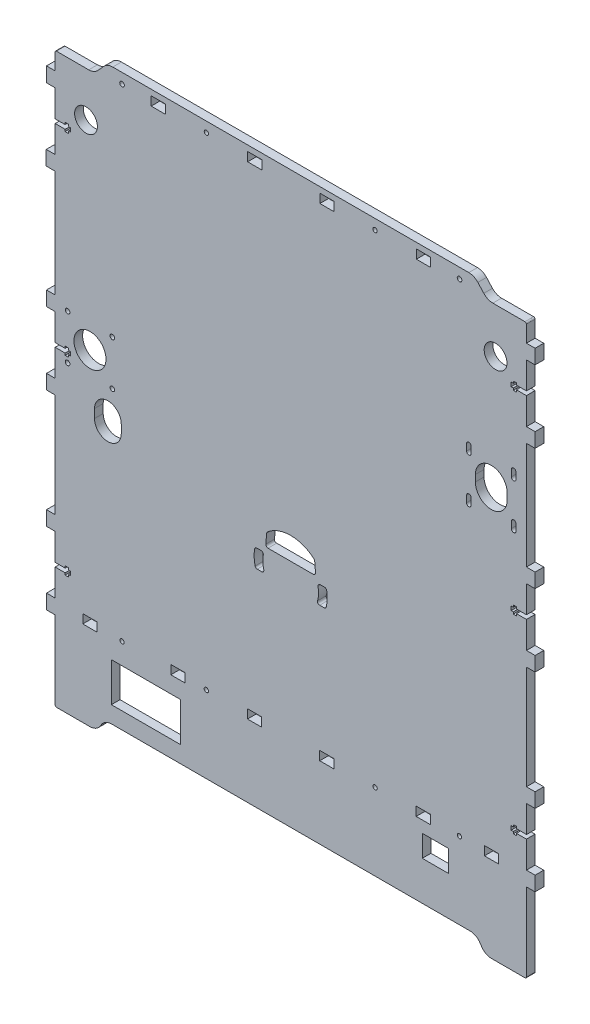
from build123d import *

# Parameters (mm, degrees)
SKETCH_1_R      = 7.9
SKETCH_1_R_2    = 1.6
SKETCH_1_R_3    = 1.5
SKETCH_1_R_4    = 11.1
SKETCH_1_W      = 9.849167497
SKETCH_1_H      = 6.19978722
SKETCH_1_W_2    = 9.849167498
SKETCH_1_H_2    = 6.199787221
SKETCH_1_W_3    = 18
SKETCH_1_H_3    = 15
SKETCH_1_W_4    = 9.849202775
SKETCH_1_W_5    = 48
SKETCH_1_H_4    = 27
SKETCH_1_W_6    = 9.849167249
SKETCH_1_W_7    = 9.849202526
SKETCH_1_W_8    = 9.849202527
EXTRUDE_1_DEPTH = 6


with BuildPart() as part:
    # Эскиз1 → Бобышка-Вытянуть1 (new body)
    with BuildSketch(Plane.XY):
        with BuildLine():
            Line((-197.694445684, 21.332964363), (-197.694445684, 19.960068421))
            Line((-197.694445684, 19.960068421), (-195.493623102, 19.960068421))
            Line((-195.493623102, 19.960068421), (-195.494445174, 21.332741303))
            Line((-195.494445174, 21.332741303), (-195.494445174, 21.359949385))
            Line((-195.494445174, 21.359949385), (-193.994445433, 21.360830251))
            Line((-193.994445433, 21.360830251), (-193.996089178, 24.132704975))
            Line((-193.996089178, 24.132704975), (-193.996089178, 24.159913057))
            Line((-193.996089178, 24.159913057), (-195.496088919, 24.159032191))
            Line((-195.496088919, 24.159032191), (-195.4969116, 25.532741364))
            Line((-195.4969116, 25.532741364), (-195.4969116, 25.559949446))
            Line((-195.4969116, 25.559949446), (-197.69691201, 25.560002787))
            Line((-197.69691201, 25.560002787), (-197.69691201, 25.532794704))
            Line((-197.69691201, 25.532794704), (-197.696945954, 24.160002787))
            Line((-197.696945954, 24.160002787), (-204.606387984, 24.161192722))
            Line((-204.606387984, 24.161192722), (-204.606387984, 42.758944112))
            Line((-204.606387984, 42.758944112), (-210.606387984, 42.758944112))
            Line((-210.606387984, 42.758944112), (-210.606387984, 52.73173603))
            Line((-210.606387984, 52.73173603), (-204.606387984, 52.73173603))
            Line((-204.606387984, 52.73173603), (-204.606387984, 126.895645125))
            Line((-204.606387984, 126.895645125), (-210.782446891, 126.895645125))
            Line((-210.782446891, 126.895645125), (-210.782446891, 136.895645125))
            Line((-210.782446891, 136.895645125), (-204.606387984, 136.895645125))
            Line((-204.606387984, 136.895645125), (-204.606387984, 155.499785996))
            Line((-204.606387984, 155.499785996), (-197.694445684, 155.499785996))
            Line((-197.694445684, 155.499785996), (-197.694445684, 154.099681972))
            Line((-197.694445684, 154.099681972), (-195.493623102, 154.099681972))
            Line((-195.493623102, 154.099681972), (-195.494445174, 155.499562936))
            Line((-195.494445174, 155.499562936), (-193.994445433, 155.500443802))
            Line((-193.994445433, 155.500443802), (-193.996089178, 158.299526608))
            Line((-193.996089178, 158.299526608), (-195.496088919, 158.298645742))
            Line((-195.496088919, 158.298645742), (-195.4969116, 159.699562997))
            Line((-195.4969116, 159.699562997), (-197.69691201, 159.699616338))
            Line((-197.69691201, 159.699616338), (-197.696945954, 158.299616338))
            Line((-197.696945954, 158.299616338), (-204.606387984, 158.300806273))
            Line((-204.606387984, 158.300806273), (-204.606387984, 176.905311214))
            Line((-204.606387984, 176.905311214), (-210.606387984, 176.905311214))
            Line((-210.606387984, 176.905311214), (-210.606387984, 187.047679378))
            Line((-210.606387984, 187.047679378), (-204.606387984, 187.047679378))
            Line((-204.606387984, 187.047679378), (-204.606387984, 198.305988871))
            ThreePointArc((-204.606387984, 198.305988871), (-204.401524219, 198.976632659), (-203.782446891, 199.305988871))
            Line((-203.782446891, 199.305988871), (-181.349535501, 199.305988871))
            ThreePointArc((-181.349535501, 199.305988871), (-177.923844093, 200.026873345), (-175.079218037, 202.06725043))
            Line((-175.079218037, 202.06725043), (-170.981328441, 206.544727313))
            ThreePointArc((-170.981328441, 206.544727313), (-168.136702385, 208.585104398), (-164.711010976, 209.305988871))
            Line((-164.711010976, 209.305988871), (81.698235008, 209.305988871))
            ThreePointArc((81.698235008, 209.305988871), (85.123926416, 208.585104398), (87.968552472, 206.544727313))
            Line((87.968552472, 206.544727313), (92.066442069, 202.06725043))
            ThreePointArc((92.066442069, 202.06725043), (94.911068125, 200.026873345), (98.336759533, 199.305988871))
            Line((98.336759533, 199.305988871), (120.593612016, 199.305988871))
            ThreePointArc((120.593612016, 199.305988871), (121.300718797, 199.013095653), (121.593612016, 198.305988871))
            Line((121.593612016, 198.305988871), (121.593612016, 186.905311214))
            Line((121.593612016, 186.905311214), (127.593612016, 186.905311214))
            Line((127.593612016, 186.905311214), (127.593612016, 176.905311214))
            Line((127.593612016, 176.905311214), (121.593612016, 176.905311214))
            Line((121.593612016, 176.905311214), (121.593612016, 158.300806273))
            Line((121.593612016, 158.300806273), (114.681610809, 158.300806273))
            Line((114.681610809, 158.300806273), (114.681610809, 159.700910297))
            Line((114.681610809, 159.700910297), (112.480788227, 159.700910297))
            Line((112.480788227, 159.700910297), (112.481610299, 158.301029333))
            Line((112.481610299, 158.301029333), (110.981610557, 158.300148467))
            Line((110.981610557, 158.300148467), (110.983254303, 155.501065661))
            Line((110.983254303, 155.501065661), (112.483254044, 155.501946527))
            Line((112.483254044, 155.501946527), (112.484076725, 154.101029272))
            Line((112.484076725, 154.101029272), (114.684077135, 154.100975932))
            Line((114.684077135, 154.100975932), (114.684111079, 155.500975931))
            Line((114.684111079, 155.500975931), (121.593612016, 155.499785996))
            Line((121.593612016, 155.499785996), (121.593612016, 136.895645125))
            Line((121.593612016, 136.895645125), (127.593612016, 136.895645125))
            Line((127.593612016, 136.895645125), (127.593612016, 126.895645125))
            Line((127.593612016, 126.895645125), (121.593612016, 126.895645125))
            Line((121.593612016, 126.895645125), (121.593612016, 52.73173603))
            Line((121.593612016, 52.73173603), (127.593612016, 52.73173603))
            Line((127.593612016, 52.73173603), (127.593612016, 42.758944112))
            Line((127.593612016, 42.758944112), (121.593612016, 42.758944112))
            Line((121.593612016, 42.758944112), (121.593612016, 24.160597755))
            Line((121.593612016, 24.160597755), (121.593612016, 24.133528549))
            Line((121.593612016, 24.133528549), (114.681610809, 24.133528549))
            Line((114.681610809, 24.133528549), (114.681610809, 24.160597755))
            Line((114.681610809, 24.160597755), (114.681610809, 25.533632573))
            Line((114.681610809, 25.533632573), (112.480788227, 25.533632573))
            Line((112.480788227, 25.533632573), (112.481610299, 24.160820814))
            Line((112.481610299, 24.160820814), (112.481610299, 24.133751609))
            Line((112.481610299, 24.133751609), (110.981610557, 24.132870742))
            Line((110.981610557, 24.132870742), (110.983254303, 21.360857142))
            Line((110.983254303, 21.360857142), (110.983254303, 21.333787936))
            Line((110.983254303, 21.333787936), (112.483254044, 21.334668803))
            Line((112.483254044, 21.334668803), (112.484076725, 19.960820753))
            Line((112.484076725, 19.960820753), (112.484076725, 19.933751548))
            Line((112.484076725, 19.933751548), (114.684077135, 19.933698207))
            Line((114.684077135, 19.933698207), (114.684077135, 19.960767413))
            Line((114.684077135, 19.960767413), (114.684111079, 21.333698207))
            Line((114.684111079, 21.333698207), (121.593612016, 21.332508272))
            Line((121.593612016, 21.332508272), (121.593612016, 2.729791245))
            Line((121.593612016, 2.729791245), (127.593612016, 2.729791245))
            Line((127.593612016, 2.729791245), (127.593612016, -7.243000673))
            Line((127.593612016, -7.243000673), (121.593612016, -7.243000673))
            Line((121.593612016, -7.243000673), (121.593612016, -78.973178087))
            Line((121.593612016, -78.973178087), (127.593612016, -78.973178087))
            Line((127.593612016, -78.973178087), (127.593612016, -88.973178087))
            Line((127.593612016, -88.973178087), (121.681612016, -88.973178087))
            Line((121.681612016, -88.973178087), (121.681612016, -107.555053324))
            Line((121.681612016, -107.555053324), (114.681610809, -107.555053324))
            Line((114.681610809, -107.555053324), (114.681610809, -106.154949299))
            Line((114.681610809, -106.154949299), (112.480788227, -106.154949299))
            Line((112.480788227, -106.154949299), (112.481610299, -107.554830264))
            Line((112.481610299, -107.554830264), (110.981610557, -107.55571113))
            Line((110.981610557, -107.55571113), (110.983254303, -110.354793936))
            Line((110.983254303, -110.354793936), (112.483254044, -110.35391307))
            Line((112.483254044, -110.35391307), (112.484076725, -111.754830325))
            Line((112.484076725, -111.754830325), (114.684077135, -111.754883665))
            Line((114.684077135, -111.754883665), (114.684111079, -110.354883666))
            Line((114.684111079, -110.354883666), (121.593612016, -110.356073601))
            Line((121.593612016, -110.356073601), (121.593612016, -128.962877955))
            Line((121.593612016, -128.962877955), (127.593612016, -128.962877955))
            Line((127.593612016, -128.962877955), (127.593612016, -138.962877955))
            Line((127.593612016, -138.962877955), (121.593612016, -138.962877955))
            Line((121.593612016, -138.962877955), (121.593612016, -193.00506208))
            ThreePointArc((121.593612016, -193.00506208), (121.256718797, -193.730394258), (120.505612016, -194.00506208))
            Line((120.505612016, -194.00506208), (97.46922711, -194.00506208))
            ThreePointArc((97.46922711, -194.00506208), (93.920971885, -193.198923704), (91.045849344, -190.968756762))
            Line((91.045849344, -190.968756762), (88.989145198, -187.949103667))
            ThreePointArc((88.989145198, -187.949103667), (86.070022656, -185.709182159), (82.477767431, -184.912798349))
            Line((82.477767431, -184.912798349), (-165.490543399, -184.912798349))
            ThreePointArc((-165.490543399, -184.912798349), (-169.082798624, -185.709182159), (-172.001921166, -187.949103667))
            Line((-172.001921166, -187.949103667), (-174.058625312, -190.968756762))
            ThreePointArc((-174.058625312, -190.968756762), (-176.977747854, -193.20867827), (-180.570003078, -194.00506208))
            Line((-180.570003078, -194.00506208), (-203.694446891, -194.00506208))
            ThreePointArc((-203.694446891, -194.00506208), (-204.357524219, -193.693931264), (-204.606387984, -193.00506208))
            Line((-204.606387984, -193.00506208), (-204.606387984, -139.056114189))
            Line((-204.606387984, -139.056114189), (-210.606387984, -139.056114189))
            Line((-210.606387984, -139.056114189), (-210.606387984, -128.962877955))
            Line((-210.606387984, -128.962877955), (-204.606387984, -128.962877955))
            Line((-204.606387984, -128.962877955), (-204.606387984, -110.355125855))
            Line((-204.606387984, -110.355125855), (-197.694445684, -110.355125855))
            Line((-197.694445684, -110.355125855), (-197.694445684, -111.75522988))
            Line((-197.694445684, -111.75522988), (-195.493623102, -111.75522988))
            Line((-195.493623102, -111.75522988), (-195.494445174, -110.355348915))
            Line((-195.494445174, -110.355348915), (-193.994445433, -110.354468049))
            Line((-193.994445433, -110.354468049), (-193.996089178, -107.555385243))
            Line((-193.996089178, -107.555385243), (-195.496088919, -107.556266109))
            Line((-195.496088919, -107.556266109), (-195.4969116, -106.155348854))
            Line((-195.4969116, -106.155348854), (-197.69691201, -106.155295514))
            Line((-197.69691201, -106.155295514), (-197.696945954, -107.555295513))
            Line((-197.696945954, -107.555295513), (-204.606387984, -107.554105578))
            Line((-204.606387984, -107.554105578), (-204.606387984, -88.973178088))
            Line((-204.606387984, -88.973178088), (-210.606387984, -88.973178088))
            Line((-210.606387984, -88.973178088), (-210.606387984, -78.973178088))
            Line((-210.606387984, -78.973178088), (-204.606387984, -78.973178088))
            Line((-204.606387984, -78.973178088), (-204.606387984, -7.243000673))
            Line((-204.606387984, -7.243000673), (-210.606387984, -7.243000673))
            Line((-210.606387984, -7.243000673), (-210.606387984, 2.729791245))
            Line((-210.606387984, 2.729791245), (-204.606387984, 2.729791245))
            Line((-204.606387984, 2.729791245), (-204.606387984, 21.332964363))
            Line((-204.606387984, 21.332964363), (-204.606387984, 21.360172445))
            Line((-204.606387984, 21.360172445), (-197.694445684, 21.360172445))
            Line((-197.694445684, 21.360172445), (-197.694445684, 21.332964363))
        make_face()
        with Locations((-183.256387984, 168.305988871)):
            Circle(SKETCH_1_R, mode=Mode.SUBTRACT)
        with Locations((100.243612016, 168.305988871)):
            Circle(SKETCH_1_R, mode=Mode.SUBTRACT)
        with Locations((-158.306387984, 202.255988871)):
            Circle(SKETCH_1_R_2, mode=Mode.SUBTRACT)
        with Locations((75.293612016, 202.255988871)):
            Circle(SKETCH_1_R_2, mode=Mode.SUBTRACT)
        with Locations((16.833556616, 202.359808159)):
            Circle(SKETCH_1_R_3, mode=Mode.SUBTRACT)
        with Locations((-99.915744154, 202.359808159)):
            Circle(SKETCH_1_R_3, mode=Mode.SUBTRACT)
        with Locations((-196.006387984, 47.305988871)):
            Circle(SKETCH_1_R_2, mode=Mode.SUBTRACT)
        with Locations((-165.006387984, 16.305988871)):
            Circle(SKETCH_1_R_2, mode=Mode.SUBTRACT)
        with Locations((-196.006387984, 16.305988871)):
            Circle(SKETCH_1_R_2, mode=Mode.SUBTRACT)
        with Locations((-180.506387984, 31.805988871)):
            Circle(SKETCH_1_R_4, mode=Mode.SUBTRACT)
        with Locations((-165.006387984, 47.305988871)):
            Circle(SKETCH_1_R_2, mode=Mode.SUBTRACT)
        with Locations((75.231627835, -131.73058328)):
            Circle(SKETCH_1_R_3, mode=Mode.SUBTRACT)
        with Locations((16.844053889, -131.689395817)):
            Circle(SKETCH_1_R_3, mode=Mode.SUBTRACT)
        with Locations((-99.94326742, -131.731436982)):
            Circle(SKETCH_1_R_3, mode=Mode.SUBTRACT)
        with Locations((-158.278561228, -131.767100286)):
            Circle(SKETCH_1_R_3, mode=Mode.SUBTRACT)
        with Locations((-16.561450589, -131.812904739)):
            Rectangle(SKETCH_1_W, SKETCH_1_H, mode=Mode.SUBTRACT)
        with Locations((-66.561491687, -131.811528906)):
            Rectangle(SKETCH_1_W_2, SKETCH_1_H_2, mode=Mode.SUBTRACT)
        with Locations((58.493612016, -150.412798349)):
            Rectangle(SKETCH_1_W_3, SKETCH_1_H_3, mode=Mode.SUBTRACT)
        with Locations((-119.607010424, -131.812904739)):
            Rectangle(SKETCH_1_W_4, SKETCH_1_H, mode=Mode.SUBTRACT)
        with Locations((-180.575547631, -131.812904739)):
            Rectangle(SKETCH_1_W_4, SKETCH_1_H, mode=Mode.SUBTRACT)
        with Locations((97.458461467, -131.812904739)):
            Rectangle(SKETCH_1_W_4, SKETCH_1_H, mode=Mode.SUBTRACT)
        with Locations((50.213120923, -131.812904739)):
            Rectangle(SKETCH_1_W_4, SKETCH_1_H, mode=Mode.SUBTRACT)
        with BuildLine():
            Line((-18.134599873, -29.194011129), (-21.184312759, -29.194011129))
            ThreePointArc((-21.184312759, -29.194011129), (-22.342493839, -29.740797309), (-22.65630504, -30.982522347))
            ThreePointArc((-22.65630504, -30.982522347), (-22.309250666, -35.408837109), (-22.983068573, -39.797308203))
            ThreePointArc((-22.983068573, -39.797308203), (-22.72917458, -41.103666451), (-21.536477135, -41.694011129))
            Line((-21.536477135, -41.694011129), (-18.440328783, -41.694011129))
            ThreePointArc((-18.440328783, -41.694011129), (-17.510284763, -41.370879057), (-16.980943477, -40.540701957))
            ThreePointArc((-16.980943477, -40.540701957), (-16.309095275, -35.507678983), (-16.655943039, -30.441872344))
            ThreePointArc((-16.655943039, -30.441872344), (-17.167182739, -29.547667337), (-18.134599873, -29.194011129))
        make_face(mode=Mode.SUBTRACT)
        with BuildLine():
            Line((-64.7445198, -41.694011128), (-61.648371447, -41.694011128))
            ThreePointArc((-61.648371447, -41.694011128), (-60.455674003, -41.103666451), (-60.201780009, -39.797308203))
            ThreePointArc((-60.201780009, -39.797308203), (-60.875597917, -35.408837109), (-60.528543542, -30.982522347))
            ThreePointArc((-60.528543542, -30.982522347), (-60.842354744, -29.740797309), (-62.000535824, -29.194011129))
            Line((-62.000535824, -29.194011129), (-65.05024871, -29.194011129))
            ThreePointArc((-65.05024871, -29.194011129), (-66.017665844, -29.547667337), (-66.528905544, -30.441872344))
            ThreePointArc((-66.528905544, -30.441872344), (-66.875753307, -35.507678983), (-66.203905105, -40.540701957))
            ThreePointArc((-66.203905105, -40.540701957), (-65.67456382, -41.370879057), (-64.7445198, -41.694011128))
        make_face(mode=Mode.SUBTRACT)
        with BuildLine():
            Line((-58.18830834, -16.824477467), (-58.795688036, -23.766859164))
            ThreePointArc((-58.795688036, -23.766859164), (-58.407311994, -24.91097809), (-57.301395989, -25.397592779))
            Line((-57.301395989, -25.397592779), (-25.883452594, -25.397592779))
            ThreePointArc((-25.883452594, -25.397592779), (-24.777536589, -24.91097809), (-24.389160547, -23.766859164))
            Line((-24.389160547, -23.766859164), (-24.996540243, -16.824477467))
            ThreePointArc((-24.996540243, -16.824477467), (-25.15785371, -16.267338924), (-25.518477328, -15.813052674))
            ThreePointArc((-25.518477328, -15.813052674), (-41.592424291, -9.897592775), (-57.666371255, -15.813052674))
            ThreePointArc((-57.666371255, -15.813052674), (-58.026994873, -16.267338924), (-58.18830834, -16.824477467))
        make_face(mode=Mode.SUBTRACT)
        with Locations((-141.692424291, -159.912798349)):
            Rectangle(SKETCH_1_W_5, SKETCH_1_H_4, mode=Mode.SUBTRACT)
        with Locations((-133.216862013, 202.263514318)):
            Rectangle(SKETCH_1_W_6, SKETCH_1_H_2, mode=Mode.SUBTRACT)
        with Locations((50.329900944, 202.263514318)):
            Rectangle(SKETCH_1_W_7, SKETCH_1_H_2, mode=Mode.SUBTRACT)
        with Locations((-66.443491633, 202.263514318)):
            Rectangle(SKETCH_1_W_8, SKETCH_1_H_2, mode=Mode.SUBTRACT)
        with Locations((-16.443451797, 202.263514318)):
            Rectangle(SKETCH_1_W_7, SKETCH_1_H_2, mode=Mode.SUBTRACT)
        with BuildLine():
            Line((-158.856387984, -7.694011129), (-158.856387984, -1.694011129))
            ThreePointArc((-158.856387984, -1.694011129), (-168.106387984, 7.555988871), (-177.356387984, -1.694011129))
            Line((-177.356387984, -1.694011129), (-177.356387984, -7.694011129))
            ThreePointArc((-177.356387984, -7.694011129), (-168.106387984, -16.944011129), (-158.856387984, -7.694011129))
        make_face(mode=Mode.SUBTRACT)
        with BuildLine():
            Line((86.257214298, 90.555988871), (86.257214298, 86.055988871))
            ThreePointArc((86.257214298, 86.055988871), (97.257214298, 75.055988871), (108.257214298, 86.055988871))
            Line((108.257214298, 86.055988871), (108.257214298, 90.555988871))
            ThreePointArc((108.257214298, 90.555988871), (97.257214298, 101.555988871), (86.257214298, 90.555988871))
        make_face(mode=Mode.SUBTRACT)
        with BuildLine():
            Line((111.157214298, 75.055988871), (111.157214298, 70.555988871))
            ThreePointArc((111.157214298, 70.555988871), (112.757214298, 68.955988871), (114.357214298, 70.555988871))
            Line((114.357214298, 70.555988871), (114.357214298, 75.055988871))
            ThreePointArc((114.357214298, 75.055988871), (112.757214298, 76.655988871), (111.157214298, 75.055988871))
        make_face(mode=Mode.SUBTRACT)
        with BuildLine():
            Line((114.357214298, 101.555988871), (114.357214298, 106.055988871))
            ThreePointArc((114.357214298, 106.055988871), (112.757214298, 107.655988871), (111.157214298, 106.055988871))
            Line((111.157214298, 106.055988871), (111.157214298, 101.555988871))
            ThreePointArc((111.157214298, 101.555988871), (112.757214298, 99.955988871), (114.357214298, 101.555988871))
        make_face(mode=Mode.SUBTRACT)
        with BuildLine():
            Line((80.157214298, 75.055988871), (80.157214298, 70.555988871))
            ThreePointArc((80.157214298, 70.555988871), (81.757214298, 68.955988871), (83.357214298, 70.555988871))
            Line((83.357214298, 70.555988871), (83.357214298, 75.055988871))
            ThreePointArc((83.357214298, 75.055988871), (81.757214298, 76.655988871), (80.157214298, 75.055988871))
        make_face(mode=Mode.SUBTRACT)
        with BuildLine():
            Line((83.357214298, 101.555988871), (83.357214298, 106.055988871))
            ThreePointArc((83.357214298, 106.055988871), (81.757214298, 107.655988871), (80.157214298, 106.055988871))
            Line((80.157214298, 106.055988871), (80.157214298, 101.555988871))
            ThreePointArc((80.157214298, 101.555988871), (81.757214298, 99.955988871), (83.357214298, 101.555988871))
        make_face(mode=Mode.SUBTRACT)
    extrude(amount=EXTRUDE_1_DEPTH)


solid = part.part
